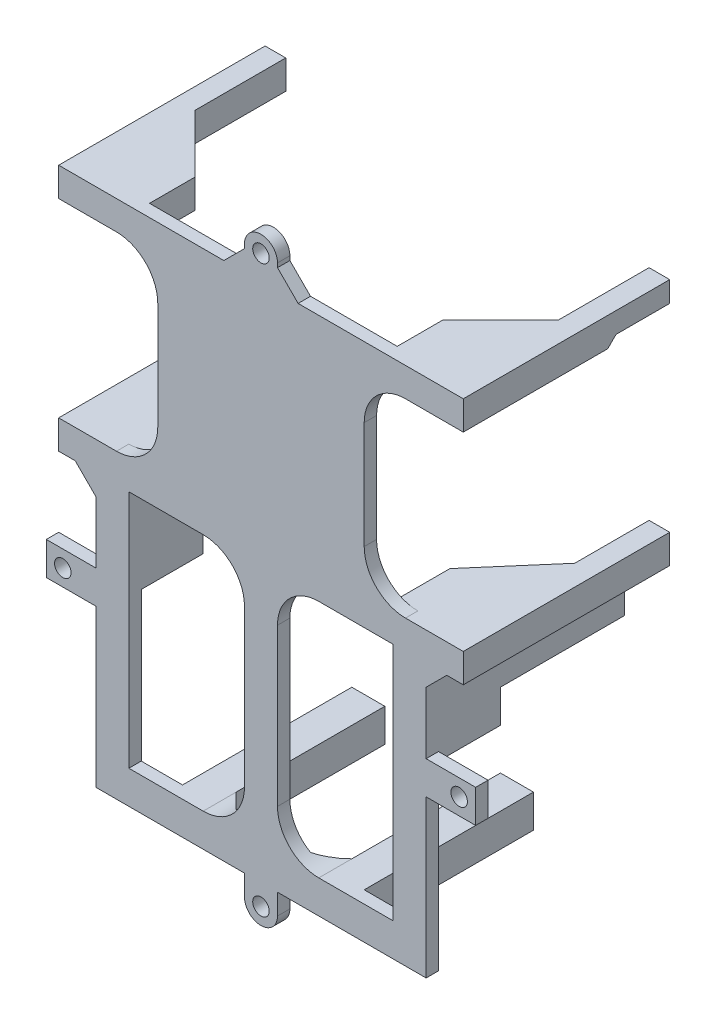
from build123d import *

# Parameters (mm, degrees)
SCHIZZO1_R                    = 2
ESTRUSIONE_ESTRUSIONE1_DEPTH  = 3
ESTRUSIONE_ESTRUSIONE2_DEPTH  = 3
SCHIZZO3_W                    = 5
SCHIZZO3_H                    = 5
ESTRUSIONE_ESTRUSIONE3_DEPTH  = 47
SCHIZZO4_R                    = 1.25
TAGLIO_ESTRUSIONE1_DEPTH      = 15
ESTRUSIONE_ESTRUSIONE4_DEPTH  = 5
ESTRUSIONE_ESTRUSIONE5_DEPTH  = 5
SCHIZZO9_W                    = 50
SCHIZZO9_H                    = 46
ESTRUSIONE_ESTRUSIONE8_DEPTH  = 3
SMUSSO1_SIZE                  = 5
SCHIZZO11_W                   = 17
SCHIZZO11_H                   = 46
SCHIZZO11_W_2                 = 64
SCHIZZO11_H_2                 = 58
TAGLIO_ESTRUSIONE3_DEPTH      = 10
SCHIZZO12_W                   = 60
SCHIZZO12_H                   = 20
TAGLIO_ESTRUSIONE4_DEPTH      = 60
SCHIZZO13_W                   = 27
SCHIZZO13_H                   = 46
TAGLIO_ESTRUSIONE5_DEPTH      = 10
RACCORDO1_R                   = 10
SCHIZZO14_W                   = 8
SCHIZZO14_H                   = 14
ESTRUSIONE_ESTRUSIONE9_DEPTH  = 45
SCHIZZO15_R                   = 1.85
TAGLIO_ESTRUSIONE6_DEPTH      = 20
SCHIZZO16_W                   = 8
SCHIZZO16_H                   = 8
ESTRUSIONE_ESTRUSIONE10_DEPTH = 15
SCHIZZO17_R                   = 1.85
TAGLIO_ESTRUSIONE7_DEPTH      = 15
SCHIZZO18_W                   = 8
SCHIZZO18_H                   = 8
ESTRUSIONE_ESTRUSIONE11_DEPTH = 41
SMUSSO3_SIZE                  = 5
SCHIZZO19_W                   = 8
SCHIZZO19_H                   = 58
ESTRUSIONE_ESTRUSIONE12_DEPTH = 3
RACCORDO2_R                   = 10
SCHIZZO20_R                   = 1.85
TAGLIO_ESTRUSIONE8_DEPTH      = 15
SCHIZZO21_W                   = 80
SCHIZZO21_H                   = 6
TAGLIO_ESTRUSIONE9_DEPTH      = 30
SMUSSO4_SIZE                  = 5
ESTRUSIONE_ESTRUSIONE13_DEPTH = 2
SCHIZZO23_W                   = 5
SCHIZZO23_H                   = 2
TAGLIO_ESTRUSIONE10_DEPTH     = 15
SMUSSO5_SIZE                  = 2
ESTRUSIONE_ESTRUSIONE14_DEPTH = 2


with BuildPart() as part:
    # Schizzo1 → Estrusione-Estrusione1 (new body)
    with BuildSketch(Plane.XY):
        with BuildLine():
            Line((4, 70), (4, 27))
            Line((4, 27), (52, 27))
            Line((52, 27), (52, 18))
            Line((52, 18), (4, 18))
            Line((4, 18), (4, -16))
            Line((4, -16), (52, -16))
            Line((52, -16), (52, -24))
            Line((52, -24), (4, -24))
            Line((4, -24), (4, -67))
            ThreePointArc((4, -67), (0, -71), (-4, -67))
            Line((-4, -67), (-4, -24))
            Line((-4, -24), (-52, -24))
            Line((-52, -24), (-52, -16))
            Line((-52, -16), (-4, -16))
            Line((-4, -16), (-4, 18))
            Line((-4, 18), (-52, 18))
            Line((-52, 18), (-52, 27))
            Line((-52, 27), (-4, 27))
            Line((-4, 27), (-4, 70))
            ThreePointArc((-4, 70), (0, 74), (4, 70))
        make_face()
        with Locations((0, 70)):
            Circle(SCHIZZO1_R, mode=Mode.SUBTRACT)
        with Locations((48, 23)):
            Circle(SCHIZZO1_R, mode=Mode.SUBTRACT)
        with Locations((-48, 23)):
            Circle(SCHIZZO1_R, mode=Mode.SUBTRACT)
        with Locations((0, -67)):
            Circle(SCHIZZO1_R, mode=Mode.SUBTRACT)
        with Locations((-48, -20)):
            Circle(SCHIZZO1_R, mode=Mode.SUBTRACT)
        with Locations((48, -20)):
            Circle(SCHIZZO1_R, mode=Mode.SUBTRACT)
    extrude(amount=ESTRUSIONE_ESTRUSIONE1_DEPTH)

    # Schizzo2 → Estrusione-Estrusione2 (add)
    with BuildSketch(Plane.XY):
        Polygon((-42, 57), (-3.921210291, 57), (-3.921210291, 64), (-49, 64), (-49, 26), (-42, 26), align=None)
        Polygon((-49, 4), (-40, 4), (-40, -62), (40, -62), (40, 4), (49, 4), (49, 18), (42, 18), (42, 11), (3.990161704, 11), (3.990161704, 4), (32, 4), (32, -54), (-32, -54), (-32, 4), (-3.921210291, 4), (-3.921210291, 11), (-42, 11), (-42, 18), (-49, 18), align=None)
        Polygon((49, 64), (49, 26), (42, 26), (42, 57), (3.990161704, 57), (3.990161704, 64), align=None)
    extrude(amount=ESTRUSIONE_ESTRUSIONE2_DEPTH)

    # Schizzo3 → Estrusione-Estrusione3 (add)
    with BuildSketch(Plane(origin=(0, 0, 0), x_dir=(-1, 0, 0), z_dir=(0, 0, -1))):
        with Locations((-46.5, 61.5)):
            Rectangle(SCHIZZO3_W, SCHIZZO3_H)
        with Locations((46.5, 61.5)):
            Rectangle(SCHIZZO3_W, SCHIZZO3_H)
        with Locations((46.5, 6.5)):
            Rectangle(SCHIZZO3_W, SCHIZZO3_H)
        with Locations((-46.5, 6.5)):
            Rectangle(SCHIZZO3_W, SCHIZZO3_H)
    extrude(amount=ESTRUSIONE_ESTRUSIONE3_DEPTH)

    # Schizzo4 → Taglio-Estrusione1 (cut)
    with BuildSketch(Plane(origin=(0, 0, -47), x_dir=(-1, 0, 0), z_dir=(0, 0, -1))):
        with Locations((-46.5, 61.5)):
            Circle(SCHIZZO4_R)
        with Locations((46.5, 61.5)):
            Circle(SCHIZZO4_R)
        with Locations((46.5, 6.5)):
            Circle(SCHIZZO4_R)
        with Locations((-46.5, 6.5)):
            Circle(SCHIZZO4_R)
    extrude(amount=-TAGLIO_ESTRUSIONE1_DEPTH, mode=Mode.SUBTRACT)

    # Schizzo5 → Estrusione-Estrusione4 (add)
    with BuildSketch(Plane.XZ.offset(-4)):
        Polygon((-44, 0), (-19, 0), (-44, -29), align=None)
        Polygon((19, 0), (44, 0), (44, -29), align=None)
    extrude(amount=-ESTRUSIONE_ESTRUSIONE4_DEPTH)

    # Schizzo6 → Estrusione-Estrusione5 (add)
    with BuildSketch(Plane(origin=(0, 64, 0), x_dir=(1, 0, 0), z_dir=(0, 1, 0))):
        Polygon((-44, 25), (-19, 0), (-44, 0), align=None)
        Polygon((44, 25), (19, 0), (44, 0), align=None)
    extrude(amount=-ESTRUSIONE_ESTRUSIONE5_DEPTH)

    # Schizzo9 → Estrusione-Estrusione8 (add)
    with BuildSketch(Plane(origin=(0, 0, 0), x_dir=(-1, 0, 0), z_dir=(0, 0, -1))):
        with Locations((0, 34)):
            Rectangle(SCHIZZO9_W, SCHIZZO9_H)
    extrude(amount=-ESTRUSIONE_ESTRUSIONE8_DEPTH)

    # Smusso1
    smusso1_edges = [part.edges().sort_by_distance(p)[0] for p in [
        (4, 64, 1.5),
        (-4, 64, 1.5),
    ]]
    chamfer(smusso1_edges, length=SMUSSO1_SIZE)

    # Schizzo11 → Taglio-Estrusione3 (cut)
    with BuildSketch(Plane(origin=(0, 0, 0), x_dir=(-1, 0, 0), z_dir=(0, 0, -1))):
        with Locations((-33.5, 34)):
            Rectangle(SCHIZZO11_W, SCHIZZO11_H)
        with Locations((33.5, 34)):
            Rectangle(SCHIZZO11_W, SCHIZZO11_H)
        with Locations((0, -25)):
            Rectangle(SCHIZZO11_W_2, SCHIZZO11_H_2)
    extrude(amount=-TAGLIO_ESTRUSIONE3_DEPTH, mode=Mode.SUBTRACT)

    # Schizzo12 → Taglio-Estrusione4 (cut)
    with BuildSketch(Plane.XZ.offset(-4)):
        with Locations((0, -10)):
            Rectangle(SCHIZZO12_W, SCHIZZO12_H)
    extrude(amount=-TAGLIO_ESTRUSIONE4_DEPTH, mode=Mode.SUBTRACT)

    # Schizzo13 → Taglio-Estrusione5 (cut)
    with BuildSketch(Plane(origin=(0, 0, 0), x_dir=(-1, 0, 0), z_dir=(0, 0, -1))):
        with Locations((38.5, 34)):
            Rectangle(SCHIZZO13_W, SCHIZZO13_H)
        with Locations((-38.5, 34)):
            Rectangle(SCHIZZO13_W, SCHIZZO13_H)
    extrude(amount=-TAGLIO_ESTRUSIONE5_DEPTH, mode=Mode.SUBTRACT)

    # Raccordo1
    raccordo1_edges = [part.edges().sort_by_distance(p)[0] for p in [
        (25, 57, 1.5),
        (-25, 11, 1.5),
        (-25, 57, 1.5),
        (25, 11, 1.5),
    ]]
    fillet(raccordo1_edges, radius=RACCORDO1_R)

    # Schizzo14 → Estrusione-Estrusione9 (add)
    with BuildSketch(Plane(origin=(0, 0, 0), x_dir=(-1, 0, 0), z_dir=(0, 0, -1))):
        with Locations((-36, -3)):
            Rectangle(SCHIZZO14_W, SCHIZZO14_H)
        with Locations((36, -3)):
            Rectangle(SCHIZZO14_W, SCHIZZO14_H)
    extrude(amount=ESTRUSIONE_ESTRUSIONE9_DEPTH)

    # Schizzo15 → Taglio-Estrusione6 (cut)
    with BuildSketch(Plane(origin=(0, 0, -45), x_dir=(-1, 0, 0), z_dir=(0, 0, -1))):
        with Locations((36, -6)):
            Circle(SCHIZZO15_R)
        with Locations((-36, -6)):
            Circle(SCHIZZO15_R)
    extrude(amount=-TAGLIO_ESTRUSIONE6_DEPTH, mode=Mode.SUBTRACT)

    # Schizzo16 → Estrusione-Estrusione10 (add)
    with BuildSketch(Plane(origin=(0, 0, 0), x_dir=(-1, 0, 0), z_dir=(0, 0, -1))):
        with Locations((-36, -14)):
            Rectangle(SCHIZZO16_W, SCHIZZO16_H)
        with Locations((36, -14)):
            Rectangle(SCHIZZO16_W, SCHIZZO16_H)
    extrude(amount=ESTRUSIONE_ESTRUSIONE10_DEPTH)

    # Schizzo17 → Taglio-Estrusione7 (cut)
    with BuildSketch(Plane(origin=(0, 0, -15), x_dir=(-1, 0, 0), z_dir=(0, 0, -1))):
        with Locations((-36, -14)):
            Circle(SCHIZZO17_R)
        with Locations((36, -14)):
            Circle(SCHIZZO17_R)
    extrude(amount=-TAGLIO_ESTRUSIONE7_DEPTH, mode=Mode.SUBTRACT)

    # Schizzo18 → Estrusione-Estrusione11 (add)
    with BuildSketch(Plane(origin=(0, 0, 0), x_dir=(-1, 0, 0), z_dir=(0, 0, -1))):
        with Locations((-18, -58)):
            Rectangle(SCHIZZO18_W, SCHIZZO18_H)
        with Locations((18, -58)):
            Rectangle(SCHIZZO18_W, SCHIZZO18_H)
    extrude(amount=ESTRUSIONE_ESTRUSIONE11_DEPTH)

    # Smusso3
    smusso3_edges = [part.edges().sort_by_distance(p)[0] for p in [
        (14, -58, 0),
        (-14, -58, 0),
    ]]
    chamfer(smusso3_edges, length=SMUSSO3_SIZE)

    # Schizzo19 → Estrusione-Estrusione12 (add)
    with BuildSketch(Plane(origin=(0, 0, 0), x_dir=(-1, 0, 0), z_dir=(0, 0, -1))):
        with Locations((0, -25)):
            Rectangle(SCHIZZO19_W, SCHIZZO19_H)
    extrude(amount=-ESTRUSIONE_ESTRUSIONE12_DEPTH)

    # Raccordo2
    raccordo2_edges = [part.edges().sort_by_distance(p)[0] for p in [
        (4, -54, 1.5),
        (-4, -54, 1.5),
        (4, 4, 1.5),
        (-4, 4, 1.5),
    ]]
    fillet(raccordo2_edges, radius=RACCORDO2_R)

    # Schizzo20 → Taglio-Estrusione8 (cut)
    with BuildSketch(Plane(origin=(0, 0, -41), x_dir=(-1, 0, 0), z_dir=(0, 0, -1))):
        with Locations((-18, -58)):
            Circle(SCHIZZO20_R)
        with Locations((18, -58)):
            Circle(SCHIZZO20_R)
    extrude(amount=-TAGLIO_ESTRUSIONE8_DEPTH, mode=Mode.SUBTRACT)

    # Schizzo21 → Taglio-Estrusione9 (cut)
    with BuildSketch(Plane(origin=(0, 0, -45), x_dir=(-1, 0, 0), z_dir=(0, 0, -1))):
        with Locations((0, 1)):
            Rectangle(SCHIZZO21_W, SCHIZZO21_H)
    extrude(amount=-TAGLIO_ESTRUSIONE9_DEPTH, mode=Mode.SUBTRACT)

    # Smusso4
    smusso4_edges = [part.edges().sort_by_distance(p)[0] for p in [
        (-40, 4, -6),
        (40, 4, -6),
    ]]
    chamfer(smusso4_edges, length=SMUSSO4_SIZE)

    # Schizzo22 → Estrusione-Estrusione13 (add)
    with BuildSketch(Plane.XZ.offset(-59)):
        Polygon((49, 0), (30, 0), (30, -11), (44, -25), (44, -47), (49, -47), align=None)
        Polygon((-30, 0), (-49, 0), (-49, -47), (-44, -47), (-44, -25), (-30, -11), align=None)
    extrude(amount=ESTRUSIONE_ESTRUSIONE13_DEPTH)

    # Schizzo23 → Taglio-Estrusione10 (cut)
    with BuildSketch(Plane(origin=(0, 0, -47), x_dir=(-1, 0, 0), z_dir=(0, 0, -1))):
        with Locations((-46.5, 58)):
            Rectangle(SCHIZZO23_W, SCHIZZO23_H)
    extrude(amount=-TAGLIO_ESTRUSIONE10_DEPTH, mode=Mode.SUBTRACT)

    # Smusso5
    smusso5_edges = [part.edges().sort_by_distance(p)[0] for p in [
        (46.5, 59, -32),
    ]]
    chamfer(smusso5_edges, length=SMUSSO5_SIZE - 0.0001)  # a hair under: the kernel refuses the full size

    # Schizzo24 → Estrusione-Estrusione14 (add)
    with BuildSketch(Plane(origin=(0, 9, 0), x_dir=(1, 0, 0), z_dir=(0, 1, 0))):
        Polygon((-49, 0), (-30, 0), (-30, 12.76), (-44, 29), (-44, 47), (-49, 47), align=None)
        Polygon((44, 47), (49, 47), (49, 0), (30, 0), (30, 12.76), (44, 29), align=None)
    extrude(amount=ESTRUSIONE_ESTRUSIONE14_DEPTH)


solid = part.part
